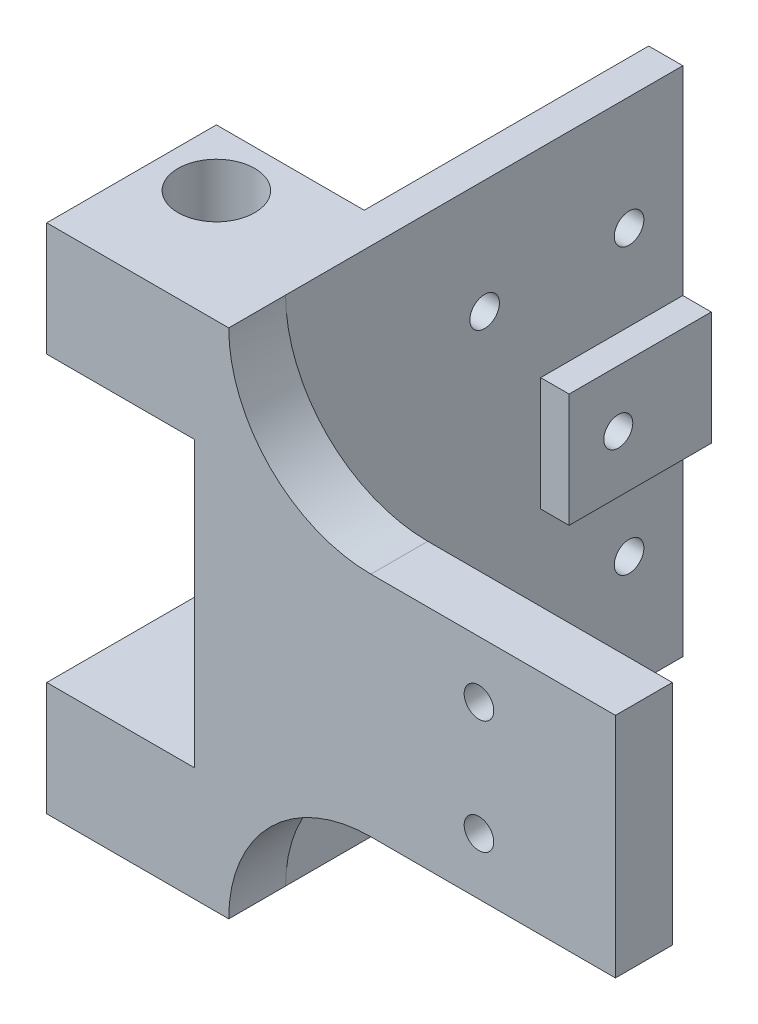
from build123d import *

# Parameters (mm, degrees)
SKETCH1_W               = 74
SKETCH1_H               = 90
SKETCH1_R               = 2.6
BOSS_EXTRUDE1_DEPTH     = 10
SKETCH2_W               = 6
SKETCH2_H               = 90
BOSS_EXTRUDE2_DEPTH     = 69.85
SKETCH4_W               = 68
SKETCH4_H               = 25
CUT_EXTRUDE3_DEPTH      = 136.849263892
FILLET2_R               = 25
SKETCH8_W               = 29.83
SKETCH8_H               = 20
BOSS_EXTRUDE4_DEPTH     = 26
SKETCH9_R               = 6.75
CUT_EXTRUDE6_DEPTH      = 10
CUT_EXTRUDE7_START      = -10
SKETCH10_R              = 6.75
CUT_EXTRUDE7_DEPTH      = 10
SKETCH11_R              = 6.35
CUT_EXTRUDE8_DEPTH      = 4.9784
SKETCH12_W              = 25
SKETCH12_H              = 20
BOSS_EXTRUDE5_DEPTH     = 5
CUT_EXTRUDE9_DEPTH      = 134.202866961
CUT_EXTRUDE9_DEPTH_BACK = 134.202866961
SKETCH13_R              = 2.55
SKETCH14_R              = 2.6
CUT_EXTRUDE10_DEPTH     = 136.849263892


with BuildPart() as part:
    # Sketch1 → Boss-Extrude1 (new body)
    with BuildSketch(Plane.XY):
        with Locations((37, 45)):
            Rectangle(SKETCH1_W, SKETCH1_H)
        with Locations((50, 55)):
            Circle(SKETCH1_R, mode=Mode.SUBTRACT)
        with Locations((50, 35)):
            Circle(SKETCH1_R, mode=Mode.SUBTRACT)
    extrude(amount=BOSS_EXTRUDE1_DEPTH)

    # Sketch2 → Boss-Extrude2 (add)
    with BuildSketch(Plane(origin=(0, 0, 0), x_dir=(-1, 0, 0), z_dir=(0, 0, -1))):
        with Locations((-3, 45)):
            Rectangle(SKETCH2_W, SKETCH2_H)
    extrude(amount=BOSS_EXTRUDE2_DEPTH)

    # Sketch4 → Cut-Extrude3 (cut, through all)
    with BuildSketch(Plane(origin=(0, 0, 0), x_dir=(-1, 0, 0), z_dir=(0, 0, -1))):
        with Locations((-40, 77.5)):
            Rectangle(SKETCH4_W, SKETCH4_H)
        with Locations((-40, 12.5)):
            Rectangle(SKETCH4_W, SKETCH4_H)
    extrude(amount=-CUT_EXTRUDE3_DEPTH, mode=Mode.SUBTRACT)

    # Fillet2
    fillet2_edges = [part.edges().sort_by_distance(p)[0] for p in [
        (6, 65, 5),
        (6, 25, 5),
    ]]
    fillet(fillet2_edges, radius=FILLET2_R - 0.0001)  # a hair under: the kernel refuses the full size

    # Sketch8 → Boss-Extrude4 (add)
    with BuildSketch(Plane.ZY):
        with Locations((-4.915, 10)):
            Rectangle(SKETCH8_W, SKETCH8_H)
        with Locations((-4.915, 80)):
            Rectangle(SKETCH8_W, SKETCH8_H)
    extrude(amount=BOSS_EXTRUDE4_DEPTH)

    # Sketch9 → Cut-Extrude6 (cut)
    with BuildSketch(Plane.XZ):
        with Locations(Location((-16, -9.83, 0), (0, 0, 270))):
            Circle(SKETCH9_R)
    extrude(amount=-CUT_EXTRUDE6_DEPTH, mode=Mode.SUBTRACT)

    # Sketch10 → Cut-Extrude7 (cut)
    with BuildSketch(Plane(origin=(0, 90, 0), x_dir=(1, 0, 0), z_dir=(0, 1, 0)).offset(CUT_EXTRUDE7_START)):
        with Locations(Location((-16, 9.83, 0), (0, 0, 90))):
            Circle(SKETCH10_R)
    extrude(amount=CUT_EXTRUDE7_DEPTH, mode=Mode.SUBTRACT)

    # Sketch11 → Cut-Extrude8 (cut)
    with BuildSketch(Plane.ZY):
        with Locations((-53.5, 45)):
            Circle(SKETCH11_R)
    extrude(amount=-CUT_EXTRUDE8_DEPTH, mode=Mode.SUBTRACT)

    # Sketch12 → Boss-Extrude5 (add)
    with BuildSketch(Plane(origin=(6, 0, 0), x_dir=(0, 0, -1), z_dir=(1, 0, 0))):
        with Locations((57.35, 45)):
            Rectangle(SKETCH12_W, SKETCH12_H)
    extrude(amount=BOSS_EXTRUDE5_DEPTH)

    # Sketch13 → Cut-Extrude9 (cut, two sides: drawn at the far end of the back side and taken through both)
    with BuildSketch(Plane.ZY.offset(-4.9784).offset(-CUT_EXTRUDE9_DEPTH_BACK)):
        with Locations((-53.5, 45)):
            Circle(SKETCH13_R)
    extrude(amount=CUT_EXTRUDE9_DEPTH + CUT_EXTRUDE9_DEPTH_BACK, mode=Mode.SUBTRACT)

    # Sketch14 → Cut-Extrude10 (cut, through all)
    with BuildSketch(Plane.ZY):
        with Locations((-35, 70)):
            Circle(SKETCH14_R)
        with Locations((-35, 20)):
            Circle(SKETCH14_R)
        with Locations((-60.4, 70)):
            Circle(SKETCH14_R)
        with Locations((-60.4, 20)):
            Circle(SKETCH14_R)
    extrude(amount=-CUT_EXTRUDE10_DEPTH, mode=Mode.SUBTRACT)


solid = part.part
